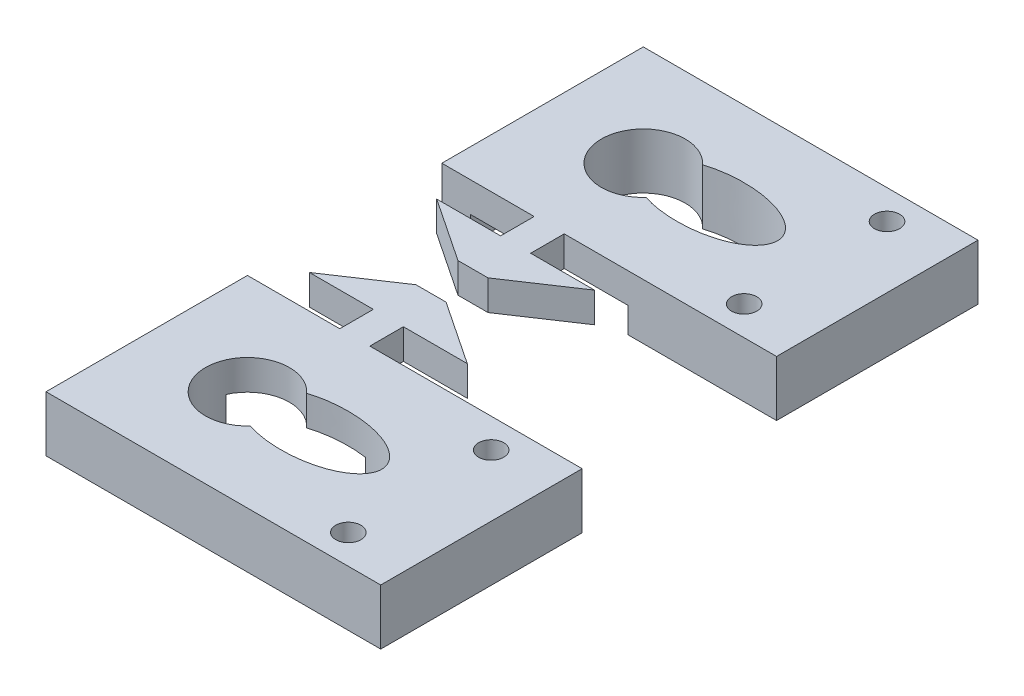
from build123d import *

# Parameters (mm, degrees)
BOSS_EXTRUDE1_DEPTH      = 3.5814
BOSS_EXTRUDE2_DEPTH      = 3.035
BOSS_EXTRUDE2_DEPTH_BACK = 3.035
SKETCH7_W                = 39.878
SKETCH7_H                = 24
CUT_EXTRUDE3_DEPTH       = 39.125273677
CUT_EXTRUDE3_DEPTH_BACK  = 39.125273677
SKETCH5_R                = 1.5
SKETCH8_W                = 18.796
SKETCH8_H                = 3.035
CUT_EXTRUDE4_DEPTH       = 10
CUT_EXTRUDE5_DEPTH       = 2
CUT_EXTRUDE6_DEPTH       = 2


with BuildPart() as part:
    # Sketch1 → Boss-Extrude1 (new body)
    with BuildSketch(Plane(origin=(0, 0, 0), x_dir=(1, 0, 0), z_dir=(0, 1, 0))):
        Polygon((-9.398, 2), (-1.7907, 2), (-1.7907, -2), (-12.79, -2), (-12.79, -26), (27.088, -26), (27.088, -2), (1.7907, -2), (1.7907, 2), (9.398, 2), (1.7907, 7.08), (-1.7907, 7.08), align=None)
    extrude(amount=BOSS_EXTRUDE1_DEPTH)

    # Sketch7 → Boss-Extrude2 (add, two sides: drawn at the far end of the back side and taken through both)
    with BuildSketch(Plane(origin=(0, 0, 0), x_dir=(1, 0, 0), z_dir=(0, 1, 0)).offset(-BOSS_EXTRUDE2_DEPTH_BACK)):
        with Locations((7.149, -14)):
            Rectangle(SKETCH7_W, SKETCH7_H)
    extrude(amount=BOSS_EXTRUDE2_DEPTH + BOSS_EXTRUDE2_DEPTH_BACK)

    # Sketch5 → Cut-Extrude3 (cut, two sides: drawn at the far end of the back side and taken through both)
    with BuildSketch(Plane(origin=(0, 3.5814, 0), x_dir=(1, 0, 0), z_dir=(0, 1, 0)).offset(-CUT_EXTRUDE3_DEPTH_BACK)):
        with BuildLine():
            ThreePointArc((2.902928009, -10.629201472), (-5.79, -14), (2.902928009, -17.370798528))
            add(Edge.make_bspline(
                [(2.902928009, -17.370798528), (15.21, -21.302170028), (15.21, -14)],
                knots=[1.002278043, 1.002278043, 1.002278043, 3.141592654, 3.141592654, 3.141592654], degree=2, weights=[1, 0.480424813, 1]))
            add(Edge.make_bspline(
                [(15.21, -14), (15.21, -6.697829972), (2.902928009, -10.629201472)],
                knots=[3.141592654, 3.141592654, 3.141592654, 5.280907265, 5.280907265, 5.280907265], degree=2, weights=[1, 0.480424813, 1]))
        make_face()
        with Locations((19.738, -22.509)):
            Circle(SKETCH5_R)
        with Locations((19.738, -5.491)):
            Circle(SKETCH5_R)
    extrude(amount=CUT_EXTRUDE3_DEPTH + CUT_EXTRUDE3_DEPTH_BACK, mode=Mode.SUBTRACT)

    # Sketch8 → Cut-Extrude4 (cut)
    with BuildSketch(Plane(origin=(0, 0, 2), x_dir=(-1, 0, 0), z_dir=(0, 0, -1))):
        with Locations((0, -1.5175)):
            Rectangle(SKETCH8_W, SKETCH8_H)
    extrude(amount=-CUT_EXTRUDE4_DEPTH, mode=Mode.SUBTRACT)


with BuildPart() as body_2:
    # Mirror2: mirrored copy
    add(part.part.mirror(Plane(origin=(0, 0, -9.58), x_dir=(1, 0, 0), z_dir=(0, 0, -1))))

    # Sketch9 → Cut-Extrude5 (cut)
    with BuildSketch(Plane(origin=(0, -3.035, 0), x_dir=(-1, 0, 0), z_dir=(0, -1, 0))):
        Polygon((-17.738, 37.345897436), (-17.738, 36.776025641), (-23.436717949, 36.776025641), (-23.436717949, 34.333717949), (-24.088, 34.333717949), (-24.088, 37.345897436), align=None)
        Polygon((-17.575179487, 32.868333333), (-17.575179487, 32.298461538), (-19.447615385, 32.298461538), (-19.447615385, 31.484358974), (-20.017487179, 31.484358974), (-20.017487179, 32.298461538), (-24.088, 32.298461538), (-24.088, 32.868333333), (-20.017487179, 32.868333333), (-20.017487179, 33.682435897), (-19.447615385, 33.682435897), (-19.447615385, 32.868333333), align=None)
        with BuildLine():
            add(Edge.make_bspline(
                [(-23.111076923, 29.815448718), (-23.113108733, 29.78006343), (-23.117068442, 29.711102542), (-23.146170333, 29.61124509), (-23.195273601, 29.519993403), (-23.262741993, 29.43921361), (-23.343290074, 29.37207525), (-23.434309956, 29.32240698), (-23.534456908, 29.291971139), (-23.604412572, 29.288209003), (-23.64024359, 29.286282051)],
                knots=[0, 0, 0, 0, 1.020591893, 1.988988293, 2.974634352, 3.991697318, 5.008760285, 5.983632262, 6.967224335, 8, 8, 8, 8], degree=3))
            add(Edge.make_bspline(
                [(-23.64024359, 29.286282051), (-23.675213037, 29.28828598), (-23.744291317, 29.292244521), (-23.843680497, 29.322343791), (-23.934760899, 29.372464128), (-24.016404016, 29.438755355), (-24.084016838, 29.520013061), (-24.132682258, 29.611465704), (-24.163820493, 29.710863151), (-24.167516873, 29.780023146), (-24.169410256, 29.815448718)],
                knots=[0, 0, 0, 0, 1.009852967, 1.994853009, 2.971120474, 3.99910934, 5.017628188, 6.004685157, 6.977947174, 8, 8, 8, 8], degree=3))
            add(Edge.make_bspline(
                [(-24.169410256, 29.815448718), (-24.167445792, 29.850848781), (-24.163588082, 29.92036554), (-24.133304061, 30.020135394), (-24.083550278, 30.111034458), (-24.016528984, 30.192307987), (-23.934337962, 30.258048617), (-23.844300579, 30.310477937), (-23.744004211, 30.338168669), (-23.675156488, 30.342446223), (-23.64024359, 30.344615385)],
                knots=[0, 0, 0, 0, 1.021616397, 2.006195831, 2.982046417, 4.000130345, 5.027680246, 6.00943514, 6.990578253, 8, 8, 8, 8], degree=3))
            add(Edge.make_bspline(
                [(-23.64024359, 30.344615385), (-23.604471141, 30.34251732), (-23.534748731, 30.33842808), (-23.433690127, 30.310413721), (-23.343708979, 30.258444682), (-23.262618275, 30.191848646), (-23.195738663, 30.111054431), (-23.145557951, 30.020349834), (-23.117297414, 29.920130272), (-23.113178168, 29.850809531), (-23.111076923, 29.815448718)],
                knots=[0, 0, 0, 0, 1.032329927, 2.012066096, 2.992413168, 4.009037178, 5.025661188, 6.000112418, 6.979848586, 8, 8, 8, 8], degree=3))
        make_face()
    extrude(amount=-CUT_EXTRUDE5_DEPTH, mode=Mode.SUBTRACT)


with BuildPart() as part_1:
    add(part.part)

    # Sketch10 → Cut-Extrude6 (cut)
    # profile 1 of 3: a face of its own
    with BuildSketch(Plane.XZ.offset(3.035)):
        with BuildLine():
            add(Edge.make_bspline(
                [(23.111076923, 18.400961538), (23.113178168, 18.436322352), (23.117297414, 18.505643093), (23.145557951, 18.605862654), (23.195738663, 18.696567251), (23.262618275, 18.777361467), (23.343708979, 18.843957503), (23.433690127, 18.895926542), (23.534748731, 18.9239409), (23.604471141, 18.92803014), (23.64024359, 18.930128205)],
                knots=[0, 0, 0, 0, 1.020151414, 1.999887582, 2.974338812, 3.990962822, 5.007586832, 5.987933904, 6.967670073, 8, 8, 8, 8], degree=3))
            add(Edge.make_bspline(
                [(23.64024359, 18.930128205), (23.675162482, 18.927965725), (23.744022024, 18.923701346), (23.844231632, 18.895913902), (23.934315979, 18.84402059), (24.015216612, 18.776937749), (24.083711596, 18.697050426), (24.133227025, 18.605578876), (24.163608262, 18.505896524), (24.167452601, 18.436367731), (24.169410256, 18.400961538)],
                knots=[0, 0, 0, 0, 1.009624703, 1.990965087, 2.972917375, 3.991206001, 5.017354006, 5.993400798, 6.978178195, 8, 8, 8, 8], degree=3))
            add(Edge.make_bspline(
                [(24.169410256, 18.400961538), (24.167523665, 18.365529847), (24.163840545, 18.296357903), (24.13260605, 18.197047191), (24.084184092, 18.105018118), (24.01509192, 18.025151555), (23.934734447, 17.957525099), (23.843611229, 17.907934065), (23.744309211, 17.877737333), (23.675219051, 17.873792076), (23.64024359, 17.871794872)],
                knots=[0, 0, 0, 0, 1.022258411, 1.995716197, 2.98297171, 4.009558169, 5.028281891, 6.00474573, 6.989943903, 8, 8, 8, 8], degree=3))
            add(Edge.make_bspline(
                [(23.64024359, 17.871794872), (23.604412572, 17.873721823), (23.534456908, 17.87748396), (23.434309956, 17.9079198), (23.343290074, 17.957588071), (23.262741993, 18.02472643), (23.195273601, 18.105506224), (23.146170333, 18.196757911), (23.117068442, 18.296615362), (23.113108733, 18.36557625), (23.111076923, 18.400961538)],
                knots=[0, 0, 0, 0, 1.032775665, 2.016367738, 2.991239715, 4.008302682, 5.025365648, 6.011011707, 6.979408107, 8, 8, 8, 8], degree=3))
        make_face()
    # profile 2 of 3: a face of its own
    with BuildSketch(Plane.XZ.offset(3.035)):
        Polygon((17.575179487, 15.348076923), (17.575179487, 15.917948718), (19.447615385, 15.917948718), (19.447615385, 16.732051282), (20.017487179, 16.732051282), (20.017487179, 15.917948718), (24.088, 15.917948718), (24.088, 15.348076923), (20.017487179, 15.348076923), (20.017487179, 14.533974359), (19.447615385, 14.533974359), (19.447615385, 15.348076923), align=None)
    # profile 3 of 3: a face of its own
    with BuildSketch(Plane.XZ.offset(3.035)):
        with BuildLine():
            Line((17.738, 9.567948718), (17.738, 10.838711939))
            add(Edge.make_bspline(
                [(17.738, 10.838711939), (17.738282277, 10.923513701), (17.738824281, 11.086342477), (17.741846451, 11.319611125), (17.750508497, 11.531568858), (17.757962641, 11.722104852), (17.771555163, 11.891215612), (17.784546623, 12.039419696), (17.801553122, 12.166034519), (17.817347246, 12.242680564), (17.824498397, 12.277383814)],
                knots=[0, 0, 0, 0, 1.410062039, 2.707475311, 3.878576406, 4.937260626, 5.877586885, 6.699081471, 7.410979367, 8, 8, 8, 8], degree=3))
            add(Edge.make_bspline(
                [(17.824498397, 12.277383814), (17.835976988, 12.32384151), (17.858689301, 12.415765834), (17.906694128, 12.548118621), (17.96224853, 12.674235532), (18.027490962, 12.79360412), (18.102941892, 12.905584306), (18.187164461, 13.011488405), (18.279988558, 13.110972648), (18.382250961, 13.202738685), (18.491772821, 13.286094467), (18.608253551, 13.359210327), (18.731211529, 13.420991884), (18.860838269, 13.469474548), (18.995701849, 13.510156831), (19.137178756, 13.537490314), (19.284796694, 13.554516403), (19.385237963, 13.556198413), (19.436167067, 13.557051282)],
                knots=[0, 0, 0, 0, 1.02737844, 2.032840108, 3.019645024, 3.985760442, 4.950801802, 5.916702504, 6.889791722, 7.870143693, 8.864820395, 9.842884691, 10.820524757, 11.815201459, 12.812418953, 13.84314332, 14.906358105, 16, 16, 16, 16], degree=3))
            add(Edge.make_bspline(
                [(19.436167067, 13.557051282), (19.520776471, 13.5543861), (19.685871333, 13.549185639), (19.925467504, 13.500698665), (20.148968117, 13.421275551), (20.35609176, 13.311831869), (20.542801074, 13.172459392), (20.706795186, 13.004955842), (20.844027599, 12.809227776), (20.939191973, 12.627020302), (21.000139107, 12.466067397), (21.043022215, 12.333564101), (21.076154638, 12.189025442), (21.105836592, 12.033836278), (21.128246094, 11.867350789), (21.144659201, 11.689968003), (21.154917261, 11.501561413), (21.156444899, 11.372131959), (21.157230769, 11.305548878)],
                knots=[0, 0, 0, 0, 1.260483769, 2.459530307, 3.627416485, 4.787058657, 5.939039949, 7.08810263, 8.267026773, 9.491475466, 10.141966685, 10.831826277, 11.566392101, 12.351337768, 13.187381173, 14.07005841, 15.007169909, 16, 16, 16, 16], degree=3))
            Line((21.157230769, 11.305548878), (24.088, 13.638461538))
            Line((24.088, 13.638461538), (24.088, 12.933754006))
            Line((24.088, 12.933754006), (21.157230769, 10.600841346))
            Line((21.157230769, 10.600841346), (21.157230769, 10.137820513))
            Line((21.157230769, 10.137820513), (24.088, 10.137820513))
            Line((24.088, 10.137820513), (24.088, 9.567948718))
            Line((24.088, 9.567948718), (17.738, 9.567948718))
        make_face()
        with BuildLine():
            Line((18.389282051, 10.137820513), (20.505948718, 10.137820513))
            Line((20.505948718, 10.137820513), (20.514852965, 11.300460737))
            add(Edge.make_bspline(
                [(20.514852965, 11.300460737), (20.514876994, 11.354744243), (20.514923569, 11.459961139), (20.507677529, 11.612180821), (20.499435294, 11.75391335), (20.48682505, 11.88461477), (20.470583229, 12.004349543), (20.450234815, 12.113037944), (20.426629591, 12.210922238), (20.389715634, 12.324713915), (20.333786234, 12.453282147), (20.246917826, 12.589952932), (20.142539044, 12.709870581), (20.019736564, 12.8075346), (19.886860538, 12.889361136), (19.742550068, 12.94442714), (19.591486445, 12.981126295), (19.487693972, 12.985138493), (19.434895032, 12.987179487)],
                knots=[0, 0, 0, 0, 1.146477201, 2.22219935, 3.21835465, 4.145220026, 4.995151787, 5.769831222, 6.480173269, 7.120302478, 8.295254187, 9.430763426, 10.528629691, 11.636497428, 12.733230534, 13.811001502, 14.886462612, 16, 16, 16, 16], degree=3))
            add(Edge.make_bspline(
                [(19.434895032, 12.987179487), (19.383833269, 12.984992201), (19.282647488, 12.980657799), (19.134439291, 12.945464462), (18.994516998, 12.885297932), (18.862699948, 12.806148597), (18.744914152, 12.706815842), (18.64304065, 12.592580192), (18.559643163, 12.46346363), (18.504214172, 12.343849565), (18.471663171, 12.236079685), (18.448004083, 12.142954149), (18.431583793, 12.037213809), (18.416030786, 11.919339538), (18.403440206, 11.789106381), (18.394755396, 11.646132636), (18.38966918, 11.491303978), (18.389414097, 11.383995031), (18.389282051, 11.328445513)],
                knots=[0, 0, 0, 0, 1.100823979, 2.181431445, 3.263702604, 4.376021382, 5.48638238, 6.575013887, 7.666064109, 8.791843368, 9.405226397, 10.093019944, 10.863016055, 11.711746407, 12.658404307, 13.684961631, 14.801597923, 16, 16, 16, 16], degree=3))
            Line((18.389282051, 11.328445513), (18.389282051, 10.137820513))
        make_face(mode=Mode.SUBTRACT)
    extrude(amount=-CUT_EXTRUDE6_DEPTH, mode=Mode.SUBTRACT)


solid = Compound([body_2.part, part_1.part])
